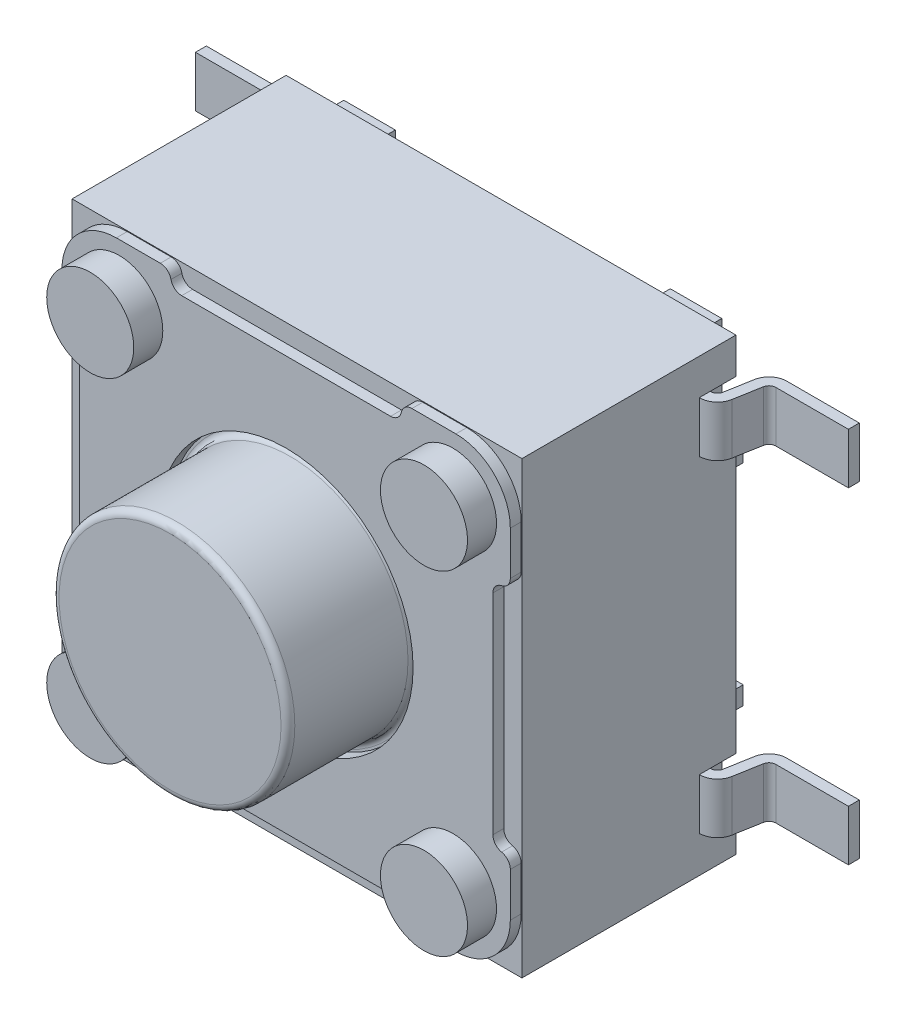
from build123d import *

# Parameters (mm, degrees)
ESQUISSE1_W                         = 6.2
ESQUISSE1_H                         = 6.2
BOSS_EXTRU_1_DEPTH                  = 2.95
BOSS_EXTRU_2_DEPTH                  = 0.3
ESQUISSE3_W                         = 0.2
ESQUISSE3_H                         = 2.65
ENL_V_MAT_EXTRU_1_DEPTH             = 8.494831552
ESQUISSE4_W                         = 3.79
ESQUISSE4_H                         = 1.325
ENL_V_MAT_EXTRU_2_DEPTH             = 0.2
ESQUISSE5_W                         = 3.79
ESQUISSE5_H                         = 1.325
ENL_V_MAT_EXTRU_3_DEPTH             = 0.2
ESQUISSE6_W                         = 0.3475
ESQUISSE6_H                         = 0.71
ENL_V_MAT_EXTRU_4_DEPTH             = 0.5
ESQUISSE7_W                         = 0.5
ESQUISSE7_H                         = 0.71
ENL_V_MAT_EXTRU_5_DEPTH             = 0.3475
ESQUISSE8_W                         = 0.3475
ESQUISSE8_H                         = 0.71
ENL_V_MAT_EXTRU_6_DEPTH             = 0.5
ESQUISSE9_W                         = 0.3475
ESQUISSE9_H                         = 0.71
ENL_V_MAT_EXTRU_7_DEPTH             = 0.5
BOSS_EXTRU_3_DEPTH                  = 0.15
DIAM_TRE_DU_PER_AGE_3_5_3_5_1_D     = 3.5
DIAM_TRE_DU_PER_AGE_3_5_3_5_1_DEPTH = 0.15
ESQUISSE13_W                        = 0.6
ESQUISSE13_H                        = 0.4
ESQUISSE14_W                        = 0.6
ESQUISSE14_H                        = 0.4
ESQUISSE15_W                        = 0.6
ESQUISSE15_H                        = 0.4
ESQUISSE16_W                        = 0.6
ESQUISSE16_H                        = 0.4
ESQUISSE17_W                        = 1.625
ESQUISSE17_H                        = 1.75
NERVURE1_START                      = -0.35
NERVURE1_DEPTH                      = 0.7
NERVURE2_START                      = -0.35
NERVURE2_DEPTH                      = 0.7
NERVURE3_START                      = -0.35
NERVURE3_DEPTH                      = 0.7
NERVURE4_START                      = -0.35
NERVURE4_DEPTH                      = 0.7
CONG_1_R                            = 0.095
CONG_2_R                            = 0.245
CONG_3_R                            = 0.75


# Read off the part's stored shape, not the designer's step: Nervure1, Nervure2, Nervure3, Nervure4
with BuildPart() as part:
    # Esquisse1 → Boss.-Extru.1 (new body)
    with BuildSketch(Plane(origin=(0, 0, 0.3), x_dir=(-1, 0, 0), z_dir=(0, 0, -1))):
        Rectangle(ESQUISSE1_W, ESQUISSE1_H)
    extrude(amount=-BOSS_EXTRU_1_DEPTH)

    # Esquisse2 → Boss.-Extru.2 (add)
    with BuildSketch(Plane(origin=(0, 0, 0.3), x_dir=(-1, 0, 0), z_dir=(0, 0, -1))):
        Polygon((-2.9, 1.575), (-2.605, 1.575), (-2.605, 2.9), (2.605, 2.9), (2.605, 1.575), (2.9, 1.575), (2.9, -1.575), (2.605, -1.575), (2.605, -2.9), (-2.605, -2.9), (-2.605, -1.575), (-2.9, -1.575), align=None)
    extrude(amount=BOSS_EXTRU_2_DEPTH)

    # Esquisse3 → Enlèv. mat.-Extru.1 (cut, through all)
    with BuildSketch(Plane.ZY.offset(2.9)):
        with Locations((0.1, 0)):
            Rectangle(ESQUISSE3_W, ESQUISSE3_H)
    extrude(amount=-ENL_V_MAT_EXTRU_1_DEPTH, mode=Mode.SUBTRACT)

    # Esquisse4 → Enlèv. mat.-Extru.2 (cut)
    with BuildSketch(Plane(origin=(0, 0, 0), x_dir=(-1, 0, 0), z_dir=(0, 0, -1))):
        with Locations((0, -2.2375)):
            Rectangle(ESQUISSE4_W, ESQUISSE4_H)
    extrude(amount=-ENL_V_MAT_EXTRU_2_DEPTH, mode=Mode.SUBTRACT)

    # Esquisse5 → Enlèv. mat.-Extru.3 (cut)
    with BuildSketch(Plane(origin=(0, 0, 0), x_dir=(-1, 0, 0), z_dir=(0, 0, -1))):
        with Locations((0, 2.2375)):
            Rectangle(ESQUISSE5_W, ESQUISSE5_H)
    extrude(amount=-ENL_V_MAT_EXTRU_3_DEPTH, mode=Mode.SUBTRACT)

    # Esquisse6 → Enlèv. mat.-Extru.4 (cut)
    with BuildSketch(Plane(origin=(0, 0, 0.3), x_dir=(-1, 0, 0), z_dir=(0, 0, -1))):
        with Locations((2.92625, -2.25)):
            Rectangle(ESQUISSE6_W, ESQUISSE6_H)
    extrude(amount=-ENL_V_MAT_EXTRU_4_DEPTH, mode=Mode.SUBTRACT)

    # Esquisse7 → Enlèv. mat.-Extru.5 (cut)
    with BuildSketch(Plane.ZY.offset(3.1)):
        with Locations((0.55, 2.25)):
            Rectangle(ESQUISSE7_W, ESQUISSE7_H)
    extrude(amount=-ENL_V_MAT_EXTRU_5_DEPTH, mode=Mode.SUBTRACT)

    # Esquisse8 → Enlèv. mat.-Extru.6 (cut)
    with BuildSketch(Plane(origin=(0, 0, 0.3), x_dir=(-1, 0, 0), z_dir=(0, 0, -1))):
        with Locations((-2.92625, -2.25)):
            Rectangle(ESQUISSE8_W, ESQUISSE8_H)
    extrude(amount=-ENL_V_MAT_EXTRU_6_DEPTH, mode=Mode.SUBTRACT)

    # Esquisse9 → Enlèv. mat.-Extru.7 (cut)
    with BuildSketch(Plane(origin=(0, 0, 0.3), x_dir=(-1, 0, 0), z_dir=(0, 0, -1))):
        with Locations((-2.92625, 2.25)):
            Rectangle(ESQUISSE9_W, ESQUISSE9_H)
    extrude(amount=-ENL_V_MAT_EXTRU_7_DEPTH, mode=Mode.SUBTRACT)

    # Esquisse10 → Boss.-Extru.3 (add)
    with BuildSketch(Plane.XY.offset(3.25)):
        with BuildLine():
            Line((1.446061231, -2.85), (-1.446061231, -2.85))
            ThreePointArc((-1.446061231, -2.85), (-1.540929561, -2.8838105), (-1.593030615, -2.97))
            ThreePointArc((-1.593030615, -2.97), (-1.64513167, -3.0561895), (-1.74, -3.09))
            Line((-1.74, -3.09), (-3.09, -3.09))
            Line((-3.09, -3.09), (-3.09, -1.74))
            ThreePointArc((-3.09, -1.74), (-3.0561895, -1.64513167), (-2.97, -1.593030615))
            ThreePointArc((-2.97, -1.593030615), (-2.8838105, -1.540929561), (-2.85, -1.446061231))
            Line((-2.85, -1.446061231), (-2.85, 1.446061231))
            ThreePointArc((-2.85, 1.446061231), (-2.8838105, 1.540929561), (-2.97, 1.593030615))
            ThreePointArc((-2.97, 1.593030615), (-3.0561895, 1.64513167), (-3.09, 1.74))
            Line((-3.09, 1.74), (-3.09, 3.09))
            Line((-3.09, 3.09), (-1.733938769, 3.09))
            ThreePointArc((-1.733938769, 3.09), (-1.639070439, 3.0561895), (-1.586969385, 2.97))
            ThreePointArc((-1.586969385, 2.97), (-1.53486833, 2.8838105), (-1.44, 2.85))
            Line((-1.44, 2.85), (1.44, 2.85))
            ThreePointArc((1.44, 2.85), (1.53486833, 2.8838105), (1.586969385, 2.97))
            ThreePointArc((1.586969385, 2.97), (1.639070439, 3.0561895), (1.733938769, 3.09))
            Line((1.733938769, 3.09), (3.09, 3.09))
            Line((3.09, 3.09), (3.09, 1.74))
            ThreePointArc((3.09, 1.74), (3.0561895, 1.64513167), (2.97, 1.593030615))
            ThreePointArc((2.97, 1.593030615), (2.8838105, 1.540929561), (2.85, 1.446061231))
            Line((2.85, 1.446061231), (2.85, -1.44))
            ThreePointArc((2.85, -1.44), (2.8838105, -1.53486833), (2.97, -1.586969385))
            ThreePointArc((2.97, -1.586969385), (3.0561895, -1.639070439), (3.09, -1.733938769))
            Line((3.09, -1.733938769), (3.09, -3.09))
            Line((3.09, -3.09), (1.74, -3.09))
            ThreePointArc((1.74, -3.09), (1.64513167, -3.0561895), (1.593030615, -2.97))
            ThreePointArc((1.593030615, -2.97), (1.540929561, -2.8838105), (1.446061231, -2.85))
        make_face()
    extrude(amount=BOSS_EXTRU_3_DEPTH)

    # Diamètre du perçage Ø3.5 (3.5)1
    with Locations(Plane.XY.offset(3.4)):
        with Locations((0, 0)):
            Hole(DIAM_TRE_DU_PER_AGE_3_5_3_5_1_D / 2, depth=DIAM_TRE_DU_PER_AGE_3_5_3_5_1_DEPTH)

    # Esquisse13 → Révolution1 (revolve)
    with BuildSketch(Plane.XZ.offset(2.3), mode=Mode.PRIVATE) as r_volution1_sk:
        with Locations((-2, 3.6)):
            Rectangle(ESQUISSE13_W, ESQUISSE13_H)
    revolve(r_volution1_sk.sketch.rotate(Axis((-2.3, -2.3, 3.8), (0, 0, -1)), 180), axis=Axis((-2.3, -2.3, 3.8), (0, 0, -1)))

    # Esquisse14 → Révolution2 (revolve)
    with BuildSketch(Plane.XZ.offset(-2.3), mode=Mode.PRIVATE) as r_volution2_sk:
        with Locations((2.6, 3.6)):
            Rectangle(ESQUISSE14_W, ESQUISSE14_H)
    revolve(r_volution2_sk.sketch.rotate(Axis((2.3, 2.3, 3.8), (0, 0, -1)), 180), axis=Axis((2.3, 2.3, 3.8), (0, 0, -1)))

    # Esquisse15 → Révolution3 (revolve)
    with BuildSketch(Plane.XZ.offset(2.3), mode=Mode.PRIVATE) as r_volution3_sk:
        with Locations((2.6, 3.6)):
            Rectangle(ESQUISSE15_W, ESQUISSE15_H)
    revolve(r_volution3_sk.sketch.rotate(Axis((2.3, -2.3, 3.8), (0, 0, -1)), 180), axis=Axis((2.3, -2.3, 3.8), (0, 0, -1)))

    # Esquisse16 → Révolution4 (revolve)
    with BuildSketch(Plane.XZ.offset(-2.3), mode=Mode.PRIVATE) as r_volution4_sk:
        with Locations((-2, 3.6)):
            Rectangle(ESQUISSE16_W, ESQUISSE16_H)
    revolve(r_volution4_sk.sketch.rotate(Axis((-2.3, 2.3, 3.8), (0, 0, -1)), 180), axis=Axis((-2.3, 2.3, 3.8), (0, 0, -1)))

    # Esquisse17 → Révolution5 (revolve)
    with BuildSketch(Plane.XZ):
        with Locations((0.8125, 4.125)):
            Rectangle(ESQUISSE17_W, ESQUISSE17_H)
    revolve(axis=Axis((0, 0, 5), (0, 0, -1)))

    # Nervure1 outline → Nervure1 (add)
    with BuildSketch(Plane(origin=(0, -2.25, 0), x_dir=(1, 0, 0), z_dir=(0, 1, 0)).offset(NERVURE1_START)):
        with BuildLine():
            Line((4.5, -0.15), (4.5, 0))
            Line((4.5, 0), (3.29447192, 0))
            Line((3.29447192, 0), (3.179694562, -0.65))
            Line((3.179694562, -0.65), (2.7525, -0.65))
            Line((2.7525, -0.65), (2.7525, -0.8))
            Line((2.7525, -0.8), (3.1, -0.8))
            ThreePointArc((3.1, -0.8), (3.257459887, -0.742700251), (3.34126743, -0.597603136))
            Line((3.34126743, -0.597603136), (3.420305438, -0.15))
            Line((3.420305438, -0.15), (4.5, -0.15))
        make_face()
    extrude(amount=NERVURE1_DEPTH)

    # Nervure2 outline → Nervure2 (add)
    with BuildSketch(Plane(origin=(0, 2.25, 0), x_dir=(1, 0, 0), z_dir=(0, 1, 0)).offset(NERVURE2_START)):
        with BuildLine():
            Line((4.5, -0.15), (4.5, 0))
            Line((4.5, 0), (3.29447192, 0))
            Line((3.29447192, 0), (3.179694562, -0.65))
            Line((3.179694562, -0.65), (2.7525, -0.65))
            Line((2.7525, -0.65), (2.7525, -0.8))
            Line((2.7525, -0.8), (3.1, -0.8))
            ThreePointArc((3.1, -0.8), (3.257459887, -0.742700251), (3.34126743, -0.597603136))
            Line((3.34126743, -0.597603136), (3.420305438, -0.15))
            Line((3.420305438, -0.15), (4.5, -0.15))
        make_face()
    extrude(amount=NERVURE2_DEPTH)

    # Nervure3 outline → Nervure3 (add)
    with BuildSketch(Plane(origin=(0, -2.25, 0), x_dir=(1, 0, 0), z_dir=(0, 1, 0)).offset(NERVURE3_START)):
        with BuildLine():
            Line((-3.179694562, -0.65), (-3.29447192, 0))
            Line((-3.29447192, 0), (-4.5, 0))
            Line((-4.5, 0), (-4.5, -0.15))
            Line((-4.5, -0.15), (-3.420305438, -0.15))
            Line((-3.420305438, -0.15), (-3.34126743, -0.597603136))
            ThreePointArc((-3.34126743, -0.597603136), (-3.257459887, -0.742700251), (-3.1, -0.8))
            Line((-3.1, -0.8), (-2.7525, -0.8))
            Line((-2.7525, -0.8), (-2.7525, -0.65))
            Line((-2.7525, -0.65), (-3.179694562, -0.65))
        make_face()
    extrude(amount=NERVURE3_DEPTH)

    # Nervure4 outline → Nervure4 (add)
    with BuildSketch(Plane.XZ.offset(-2.25).offset(NERVURE4_START)):
        with BuildLine():
            Line((-4.5, 0.15), (-4.5, 0))
            Line((-4.5, 0), (-3.29447192, 0))
            Line((-3.29447192, 0), (-3.179694562, 0.65))
            Line((-3.179694562, 0.65), (-2.7525, 0.65))
            Line((-2.7525, 0.65), (-2.7525, 0.8))
            Line((-2.7525, 0.8), (-3.1, 0.8))
            ThreePointArc((-3.1, 0.8), (-3.257459887, 0.742700251), (-3.34126743, 0.597603136))
            Line((-3.34126743, 0.597603136), (-3.420305438, 0.15))
            Line((-3.420305438, 0.15), (-4.5, 0.15))
        make_face()
    extrude(amount=NERVURE4_DEPTH)

    # Congé1
    cong_1_edges = [part.edges().sort_by_distance(p)[0] for p in [
        (-1.625, 0, 5),
        (-1.625, 0, 3.25),
        (3.420305438, -2.25, 0.15),
        (3.179694562, -2.25, 0.65),
        (3.420305438, 2.25, 0.15),
        (3.179694562, 2.25, 0.65),
        (-3.179694562, -2.25, 0.65),
        (-3.420305438, -2.25, 0.15),
        (-3.420305438, 2.25, 0.15),
        (-3.179694562, 2.25, 0.65),
    ]]
    fillet(cong_1_edges, radius=CONG_1_R)

    # Congé2
    cong_2_edges = [part.edges().sort_by_distance(p)[0] for p in [
        (3.29447192, -2.25, 0),
        (3.29447192, 2.25, 0),
        (-3.29447192, -2.25, 0),
        (-3.29447192, 2.25, 0),
    ]]
    fillet(cong_2_edges, radius=CONG_2_R)

    # Congé3
    cong_3_edges = [part.edges().sort_by_distance(p)[0] for p in [
        (3.09, -3.09, 3.325),
        (3.09, 3.09, 3.325),
        (-3.09, 3.09, 3.325),
        (-3.09, -3.09, 3.325),
    ]]
    fillet(cong_3_edges, radius=CONG_3_R)


solid = part.part
